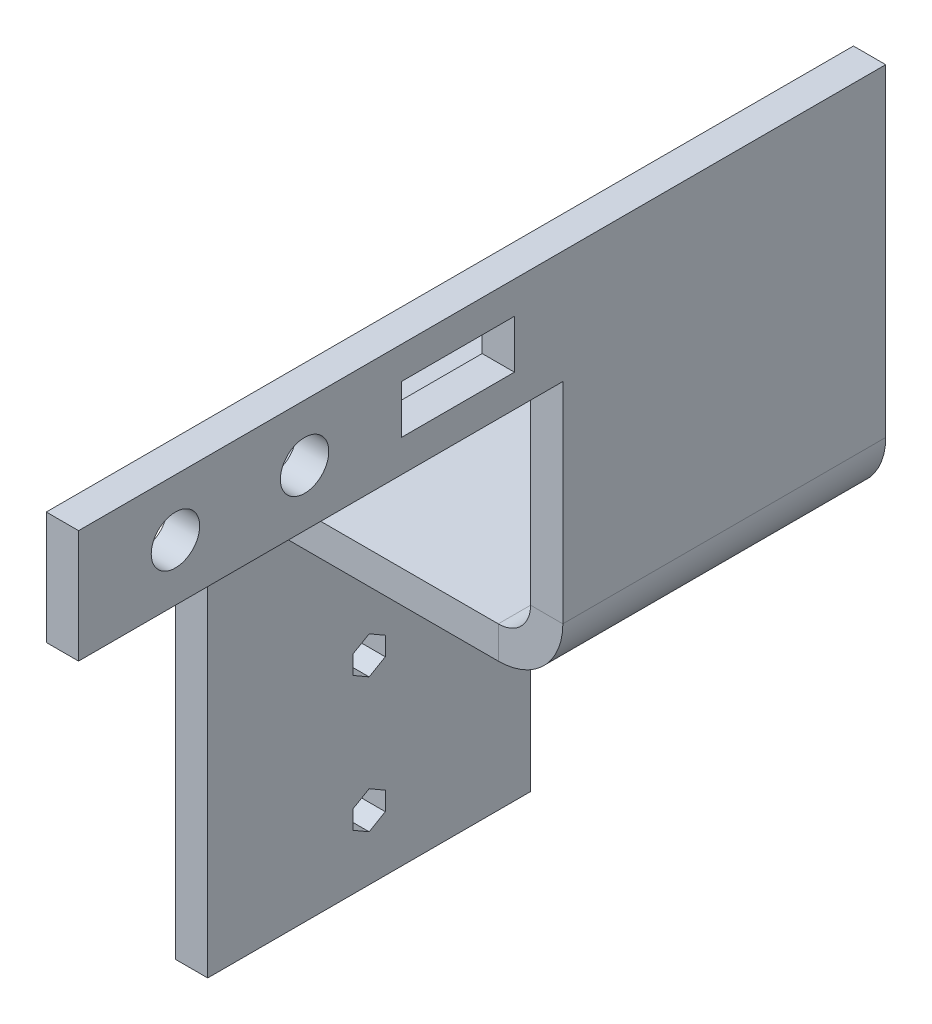
from build123d import *

# Parameters (mm, degrees)
BASE_FLANGE1_DEPTH      = 25
CUT_EXTRUDE1_DEPTH      = 38.336309405
CUT_EXTRUDE1_DEPTH_BACK = 38.336309405
SKETCH6_W               = 21.5
SKETCH6_H               = 15
CUT_EXTRUDE2_DEPTH      = 38.336309405
CUT_EXTRUDE2_DEPTH_BACK = 38.336309405
SKETCH7_R               = 0.75
SKETCH7_W               = 1.5
SKETCH7_H               = 3.5
CUT_EXTRUDE3_DEPTH      = 38.027017163
CUT_EXTRUDE3_DEPTH_BACK = 38.027017163


# Sheet-metal steps are written as plain solids
with BuildPart() as part:
    # Sketch1 → Base-Flange1 (new body)
    with BuildSketch(Plane(origin=(0, 0, 0), x_dir=(0, 1, 0), z_dir=(0, 0, 1))):
        with BuildLine():
            Line((0, 0), (12, 0))
            ThreePointArc((12, 0), (13.414213562, -0.585786438), (14, -2))
            Line((14, -2), (14, -10))
            ThreePointArc((14, -10), (14.292893219, -10.707106781), (15, -11))
            Line((15, -11), (25, -11))
            Line((25, -11), (25, -12))
            Line((25, -12), (15, -12))
            ThreePointArc((15, -12), (13.585786438, -11.414213562), (13, -10))
            Line((13, -10), (13, -2))
            ThreePointArc((13, -2), (12.707106781, -1.292893219), (12, -1))
            Line((12, -1), (0, -1))
            Line((0, -1), (0, 0))
        make_face()
    extrude(amount=BASE_FLANGE1_DEPTH)

    # Sketch6 → Cut-Extrude1 (cut, two sides: drawn at the far end of the back side and taken through both)
    with BuildSketch(Plane.YZ.offset(-CUT_EXTRUDE1_DEPTH_BACK)):
        with Locations((10.75, 17.5)):
            Rectangle(SKETCH6_W, SKETCH6_H)
    extrude(amount=CUT_EXTRUDE1_DEPTH + CUT_EXTRUDE1_DEPTH_BACK, mode=Mode.SUBTRACT)

    # Sketch7 → Cut-Extrude2 (cut, two sides: drawn at the far end of the back side and taken through both)
    with BuildSketch(Plane.YZ.offset(12).offset(-CUT_EXTRUDE2_DEPTH_BACK)):
        with Locations(Location((23.25, 22, 0), (0, 0, 90))):
            Circle(SKETCH7_R)
        with Locations(Location((23.25, 18, 0), (0, 0, 90))):
            Circle(SKETCH7_R)
        with Locations((23.25, 13.25)):
            Rectangle(SKETCH7_W, SKETCH7_H)
    extrude(amount=CUT_EXTRUDE2_DEPTH + CUT_EXTRUDE2_DEPTH_BACK, mode=Mode.SUBTRACT)

    # Sketch8 → Cut-Extrude3 (cut, two sides: drawn at the far end of the back side and taken through both)
    with BuildSketch(Plane.YZ.offset(1).offset(-CUT_EXTRUDE3_DEPTH_BACK)):
        Polygon((2.577350269, 5), (2.288675135, 5.5), (1.711324865, 5.5), (1.422649731, 5), (1.711324865, 4.5), (2.288675135, 4.5), align=None)
        Polygon((6.732050808, 5), (6.443375673, 5.5), (5.866025404, 5.5), (5.577350269, 5), (5.866025404, 4.5), (6.443375673, 4.5), align=None)
    extrude(amount=CUT_EXTRUDE3_DEPTH + CUT_EXTRUDE3_DEPTH_BACK, mode=Mode.SUBTRACT)


solid = part.part
